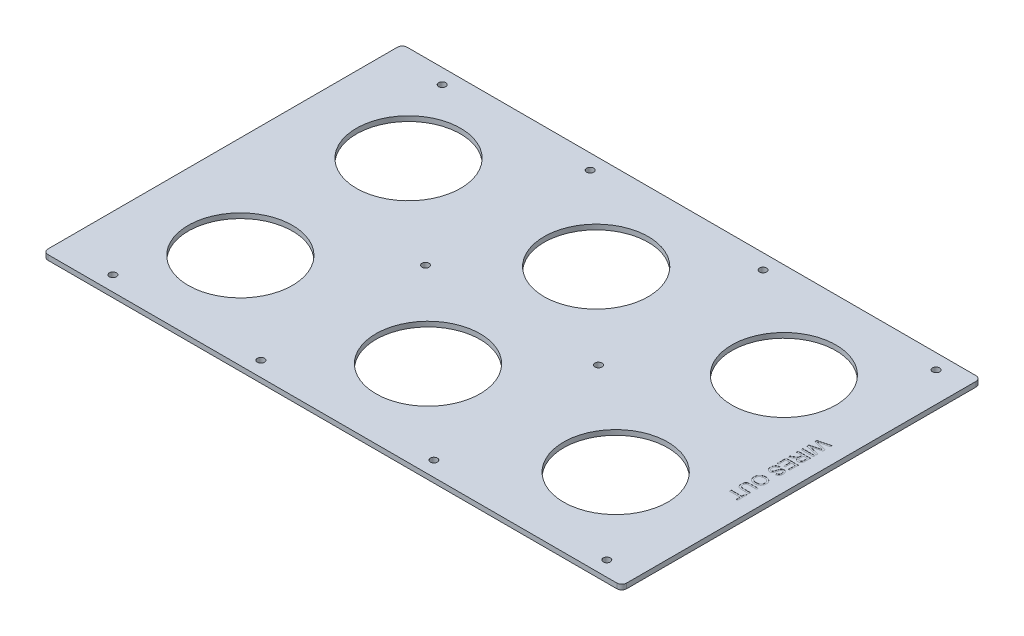
from build123d import *

# Parameters (mm, degrees)
SKETCH1_R           = 33.147
SKETCH1_R_2         = 2.2479
BOSS_EXTRUDE1_DEPTH = 3.175
SKETCH2_W           = 7.704956055
SKETCH2_H           = 1.086596366
CUT_EXTRUDE1_DEPTH  = 0.1


with BuildPart() as part:
    # Sketch1 → Boss-Extrude1 (new body)
    with BuildSketch(Plane(origin=(0, 0, 0), x_dir=(1, 0, 0), z_dir=(0, 1, 0))):
        with BuildLine():
            Line((-180.975, 114.3), (180.975, 114.3))
            ThreePointArc((180.975, 114.3), (183.22006403, 113.37006403), (184.15, 111.125))
            Line((184.15, 111.125), (184.15, -111.125))
            ThreePointArc((184.15, -111.125), (183.22006403, -113.37006403), (180.975, -114.3))
            Line((180.975, -114.3), (-180.975, -114.3))
            ThreePointArc((-180.975, -114.3), (-183.22006403, -113.37006403), (-184.15, -111.125))
            Line((-184.15, -111.125), (-184.15, 111.125))
            ThreePointArc((-184.15, 111.125), (-183.22006403, 113.37006403), (-180.975, 114.3))
        make_face()
        with Locations((119.508581684, -53.5178)):
            Circle(SKETCH1_R, mode=Mode.SUBTRACT)
        with Locations((-55.033333333, 0)):
            Circle(SKETCH1_R_2, mode=Mode.SUBTRACT)
        with Locations((55.033333333, 0)):
            Circle(SKETCH1_R_2, mode=Mode.SUBTRACT)
        with Locations((119.508581684, 53.5178)):
            Circle(SKETCH1_R, mode=Mode.SUBTRACT)
        with Locations((0.064290842, 53.5178)):
            Circle(SKETCH1_R, mode=Mode.SUBTRACT)
        with Locations((0.064290842, -53.5178)):
            Circle(SKETCH1_R, mode=Mode.SUBTRACT)
        with Locations((-119.38, 53.5178)):
            Circle(SKETCH1_R, mode=Mode.SUBTRACT)
        with Locations((-119.38, -53.5178)):
            Circle(SKETCH1_R, mode=Mode.SUBTRACT)
        with Locations((-149.225, -104.775)):
            Circle(SKETCH1_R_2, mode=Mode.SUBTRACT)
        with Locations((-55.033333333, -104.775)):
            Circle(SKETCH1_R_2, mode=Mode.SUBTRACT)
        with Locations((55.033333333, -104.775)):
            Circle(SKETCH1_R_2, mode=Mode.SUBTRACT)
        with Locations((165.1, -104.775)):
            Circle(SKETCH1_R_2, mode=Mode.SUBTRACT)
        with Locations((-149.225, 104.775)):
            Circle(SKETCH1_R_2, mode=Mode.SUBTRACT)
        with Locations((-55.033333333, 104.775)):
            Circle(SKETCH1_R_2, mode=Mode.SUBTRACT)
        with Locations((55.033333333, 104.775)):
            Circle(SKETCH1_R_2, mode=Mode.SUBTRACT)
        with Locations((165.1, 104.775)):
            Circle(SKETCH1_R_2, mode=Mode.SUBTRACT)
    extrude(amount=BOSS_EXTRUDE1_DEPTH)

    # Sketch2 → Cut-Extrude1 (cut)
    # profile 1 of 8: a face of its own
    with BuildSketch(Plane(origin=(0, 3.175, 0), x_dir=(1, 0, 0), z_dir=(0, 1, 0))):
        with BuildLine():
            Line((166.15, 27.961088352), (173.854956055, 29.901218512))
            Line((173.854956055, 29.901218512), (173.854956055, 28.779122548))
            Line((173.854956055, 28.779122548), (168.787774419, 27.635418134))
            add(Edge.make_bspline(
                [(168.787774419, 27.635418134), (168.526439394, 27.576144258), (168.006437361, 27.458201643), (167.486146355, 27.341540415), (167.227335602, 27.283509083)],
                knots=[0, 0, 0, 0, 1.00513078, 2, 2, 2, 2], degree=3))
            add(Edge.make_bspline(
                [(167.227335602, 27.283509083), (167.320397544, 27.256033068), (167.496081531, 27.204163359), (167.745130513, 27.134045564), (167.962493539, 27.070359817), (168.149183924, 27.016102829), (168.305463956, 26.972171156), (168.429413275, 26.934241048), (168.523459211, 26.908388361), (168.575307048, 26.893068011), (168.596385286, 26.886839671)],
                knots=[0, 0, 0, 0, 1.633809233, 3.084334118, 4.356383392, 5.447555203, 6.357852567, 7.089694452, 7.629924063, 8, 8, 8, 8], degree=3))
            Line((168.596385286, 26.886839671), (173.854956055, 25.364987373))
            Line((173.854956055, 25.364987373), (173.854956055, 24.05767612))
            Line((173.854956055, 24.05767612), (169.994760724, 22.957188606))
            add(Edge.make_bspline(
                [(169.994760724, 22.957188606), (169.756292996, 22.89645702), (169.286086246, 22.776707475), (168.585695874, 22.617600876), (167.902297114, 22.470750571), (167.450303241, 22.386162037), (167.227335602, 22.344434689)],
                knots=[0, 0, 0, 0, 1.04154457, 2.053700482, 3.039894486, 4, 4, 4, 4], degree=3))
            add(Edge.make_bspline(
                [(167.227335602, 22.344434689), (167.341544592, 22.318678763), (167.581775196, 22.264502978), (167.961078373, 22.179659286), (168.376649739, 22.085427655), (168.666345356, 22.020262905), (168.817100173, 21.986351796)],
                knots=[0, 0, 0, 0, 0.862132589, 1.813435466, 2.862132822, 4, 4, 4, 4], degree=3))
            Line((168.817100173, 21.986351796), (173.854956055, 20.848821224))
            Line((173.854956055, 20.848821224), (173.854956055, 19.72672526))
            Line((173.854956055, 19.72672526), (166.15, 21.668398882))
            Line((166.15, 21.668398882), (166.15, 22.863037501))
            Line((166.15, 22.863037501), (172.038302754, 24.472867061))
            add(Edge.make_bspline(
                [(172.038302754, 24.472867061), (172.095866386, 24.489032069), (172.205215852, 24.519739564), (172.361261246, 24.559989898), (172.49849675, 24.59990494), (172.618695907, 24.63165342), (172.720647484, 24.659129071), (172.804052983, 24.683459935), (172.870544784, 24.699108893), (172.908336746, 24.710425493), (172.924249224, 24.715190398)],
                knots=[0, 0, 0, 0, 1.562239628, 2.967673567, 4.210417925, 5.296319877, 6.215971374, 6.969386481, 7.566055473, 8, 8, 8, 8], degree=3))
            add(Edge.make_bspline(
                [(172.924249224, 24.715190398), (172.823339965, 24.743760525), (172.632671059, 24.797744024), (172.364249146, 24.877691092), (172.128224928, 24.944775082), (171.982204514, 24.987287741), (171.914825894, 25.00690448)],
                knots=[0, 0, 0, 0, 1.197730334, 2.263121701, 3.198547257, 4, 4, 4, 4], degree=3))
            Line((171.914825894, 25.00690448), (166.15, 26.675385549))
            Line((166.15, 26.675385549), (166.15, 27.961088352))
        make_face()
    # profile 2 of 8: a face of its own
    with BuildSketch(Plane(origin=(0, 3.175, 0), x_dir=(1, 0, 0), z_dir=(0, 1, 0))):
        with Locations((170.002478027, 18.393175174)):
            Rectangle(SKETCH2_W, SKETCH2_H)
    # profile 3 of 8: a face of its own
    with BuildSketch(Plane(origin=(0, 3.175, 0), x_dir=(1, 0, 0), z_dir=(0, 1, 0))):
        with BuildLine():
            Line((166.15, 16.071810209), (173.854956055, 16.071810209))
            Line((173.854956055, 16.071810209), (173.854956055, 12.728674228))
            add(Edge.make_bspline(
                [(173.854956055, 12.728674228), (173.854342169, 12.649953238), (173.853154065, 12.497597974), (173.844664156, 12.276657496), (173.826627338, 12.070918982), (173.80648242, 11.879085777), (173.776738051, 11.701486143), (173.741842552, 11.538035421), (173.700600095, 11.389360543), (173.651849918, 11.254330055), (173.596714064, 11.129041547), (173.528649233, 11.012939725), (173.454187738, 10.901048546), (173.36599881, 10.79779432), (173.271171835, 10.698657305), (173.165018988, 10.607025217), (173.049039409, 10.522450855), (172.88323027, 10.418093644), (172.661277756, 10.308286085), (172.378699292, 10.214565599), (172.082488889, 10.154645397), (171.880129247, 10.148194124), (171.777457888, 10.144920936)],
                knots=[0, 0, 0, 0, 1.242122331, 2.403982386, 3.487329914, 4.500326623, 5.446523787, 6.327028739, 7.136568587, 7.878666205, 8.590811102, 9.292609518, 9.999600102, 10.708452415, 11.431798422, 12.162621657, 12.917616336, 13.694634159, 15.252079616, 16.810286496, 18.381632726, 20, 20, 20, 20], degree=3))
            add(Edge.make_bspline(
                [(171.777457888, 10.144920936), (171.711548467, 10.146428673), (171.581372842, 10.149406557), (171.389979623, 10.172217122), (171.207111885, 10.213491869), (171.031164423, 10.266415741), (170.864643565, 10.338863029), (170.704098084, 10.422752234), (170.554124584, 10.526823622), (170.409729605, 10.643032409), (170.27735816, 10.778133103), (170.155231091, 10.928521812), (170.049716509, 11.097983524), (169.954892757, 11.283399851), (169.87191545, 11.485107238), (169.802148968, 11.704447002), (169.747529022, 11.940642486), (169.720168895, 12.104438229), (169.706133564, 12.188462967)],
                knots=[0, 0, 0, 0, 0.98268397, 1.940868231, 2.867803148, 3.77529712, 4.675825539, 5.571570676, 6.471608834, 7.392971743, 8.331421822, 9.286283743, 10.275919943, 11.301762849, 12.388744527, 13.524158817, 14.729930953, 16, 16, 16, 16], degree=3))
            add(Edge.make_bspline(
                [(169.706133564, 12.188462967), (169.674920512, 12.126355334), (169.615845378, 12.008807813), (169.521004725, 11.846671272), (169.427149071, 11.707441492), (169.358518569, 11.627134073), (169.32644222, 11.589600196)],
                knots=[0, 0, 0, 0, 1.172410807, 2.218954047, 3.167579294, 4, 4, 4, 4], degree=3))
            add(Edge.make_bspline(
                [(169.32644222, 11.589600196), (169.255189411, 11.516690791), (169.109061635, 11.367165608), (168.857854964, 11.163118967), (168.581599523, 10.961217248), (168.380287097, 10.839999673), (168.276888911, 10.777739843)],
                knots=[0, 0, 0, 0, 0.918170575, 1.883016652, 2.912673989, 4, 4, 4, 4], degree=3))
            Line((168.276888911, 10.777739843), (166.15, 9.51364549))
            Line((166.15, 9.51364549), (166.15, 10.759218314))
            Line((166.15, 10.759218314), (167.776807629, 11.719250899))
            add(Edge.make_bspline(
                [(167.776807629, 11.719250899), (167.83388517, 11.753770269), (167.944492072, 11.82066314), (168.106043884, 11.917264227), (168.254720969, 12.012064055), (168.39502939, 12.099702086), (168.523321014, 12.184866155), (168.643423074, 12.262773792), (168.750587872, 12.339419067), (168.879655605, 12.428558525), (169.020135853, 12.53602905), (169.163546222, 12.662288619), (169.280644656, 12.779443783), (169.393767744, 12.926020862), (169.499175465, 13.107903077), (169.548162123, 13.2621855), (169.571852479, 13.336797763)],
                knots=[0, 0, 0, 0, 1.130769053, 2.191244754, 3.190605808, 4.119719489, 4.995392299, 5.800890497, 6.546104885, 7.228445539, 8.4599972, 9.541354885, 10.466489475, 11.262010607, 12.675885558, 14, 14, 14, 14], degree=3))
            add(Edge.make_bspline(
                [(169.571852479, 13.336797763), (169.577500255, 13.368116191), (169.590394299, 13.439617099), (169.59881542, 13.561025464), (169.607753313, 13.708126592), (169.607492893, 13.814733287), (169.607352076, 13.872378643)],
                knots=[0, 0, 0, 0, 0.709978628, 1.620902492, 2.713552433, 4, 4, 4, 4], degree=3))
            Line((169.607352076, 13.872378643), (169.607352076, 14.985213842))
            Line((169.607352076, 14.985213842), (166.15, 14.985213842))
            Line((166.15, 14.985213842), (166.15, 16.071810209))
        make_face()
        with BuildLine():
            Line((170.496385467, 14.985213842), (170.496385467, 12.921606822))
            add(Edge.make_bspline(
                [(170.496385467, 12.921606822), (170.498010953, 12.818131107), (170.501049646, 12.624692964), (170.526814867, 12.354180356), (170.568207731, 12.123224381), (170.627615019, 11.927514221), (170.710466004, 11.763177743), (170.813405324, 11.621997246), (170.938654811, 11.501892323), (171.082675269, 11.403733514), (171.239816603, 11.326421186), (171.406050639, 11.27364311), (171.577781332, 11.236872937), (171.694943274, 11.233318325), (171.754305976, 11.231517303)],
                knots=[0, 0, 0, 0, 1.545806995, 2.889741191, 4.055176196, 5.047087691, 5.934047151, 6.79198357, 7.645535072, 8.5133672, 9.386595861, 10.252007348, 11.114340652, 12, 12, 12, 12], degree=3))
            add(Edge.make_bspline(
                [(171.754305976, 11.231517303), (171.797555017, 11.232951406), (171.882267182, 11.235760394), (172.00660112, 11.250486036), (172.124747101, 11.279116179), (172.237329656, 11.316922214), (172.343524199, 11.367438748), (172.44415362, 11.427450329), (172.538660191, 11.499062672), (172.627331793, 11.58109049), (172.708014285, 11.675273332), (172.777625776, 11.78285228), (172.836780526, 11.902978864), (172.88372969, 12.035792713), (172.921281378, 12.180875438), (172.946263306, 12.339052963), (172.964340145, 12.509601909), (172.965385302, 12.627782438), (172.965922664, 12.688544249)],
                knots=[0, 0, 0, 0, 0.965208469, 1.890559848, 2.786986821, 3.67262109, 4.535197034, 5.405224191, 6.282113641, 7.175449223, 8.095446547, 9.040936516, 10.026471658, 11.075712529, 12.17809725, 13.364958037, 14.645208957, 16, 16, 16, 16], degree=3))
            Line((172.965922664, 12.688544249), (172.965922664, 14.985213842))
            Line((172.965922664, 14.985213842), (170.496385467, 14.985213842))
        make_face(mode=Mode.SUBTRACT)
    # profile 4 of 8: a face of its own
    with BuildSketch(Plane(origin=(0, 3.175, 0), x_dir=(1, 0, 0), z_dir=(0, 1, 0))):
        Polygon((166.15, 8.366854154), (173.854956055, 8.366854154), (173.854956055, 2.933872321), (172.965922664, 2.933872321), (172.965922664, 7.280257787), (170.595166955, 7.280257787), (170.595166955, 3.230216784), (169.706133564, 3.230216784), (169.706133564, 7.280257787), (167.039033391, 7.280257787), (167.039033391, 2.736309345), (166.15, 2.736309345), align=None)
    # profile 5 of 8: a face of its own
    with BuildSketch(Plane(origin=(0, 3.175, 0), x_dir=(1, 0, 0), z_dir=(0, 1, 0))):
        with BuildLine():
            Line((168.817100173, 1.649712978), (168.817100173, 0.563116612))
            add(Edge.make_bspline(
                [(168.817100173, 0.563116612), (168.719529547, 0.55118181), (168.532091121, 0.528254415), (168.266572277, 0.463828653), (168.027103843, 0.381894422), (167.813378129, 0.276322875), (167.622868444, 0.143315233), (167.453133612, -0.02036123), (167.304803803, -0.218512442), (167.174859032, -0.4429847), (167.070412857, -0.691453169), (166.994464873, -0.957129776), (166.949054567, -1.23860425), (166.943227367, -1.431381137), (166.940251903, -1.529816163)],
                knots=[0, 0, 0, 0, 1.125661535, 2.162456423, 3.124646671, 4.021152204, 4.884793578, 5.777140414, 6.711097021, 7.712275503, 8.742730725, 9.791526725, 10.872317486, 12, 12, 12, 12], degree=3))
            add(Edge.make_bspline(
                [(166.940251903, -1.529816163), (166.941819683, -1.616925729), (166.944867379, -1.786262852), (166.983138859, -2.03186214), (167.036140789, -2.263122392), (167.116837446, -2.475819976), (167.216803452, -2.667610301), (167.333562111, -2.836243924), (167.470054812, -2.977492406), (167.621328485, -3.091228496), (167.781808171, -3.179580468), (167.947407209, -3.241156078), (168.114852611, -3.282617797), (168.228290067, -3.287124205), (168.284606215, -3.289361416)],
                knots=[0, 0, 0, 0, 1.267278989, 2.463534024, 3.612003651, 4.716903637, 5.765847919, 6.755281273, 7.693132489, 8.613187884, 9.50174055, 10.350585091, 11.181146174, 12, 12, 12, 12], degree=3))
            add(Edge.make_bspline(
                [(168.284606215, -3.289361416), (168.340361107, -3.286980485), (168.44944591, -3.282322178), (168.607031773, -3.246084289), (168.753131638, -3.18611117), (168.890132122, -3.103620997), (169.016624795, -2.990167719), (169.130896592, -2.845289916), (169.23753008, -2.669664303), (169.294640421, -2.537999343), (169.324898759, -2.468240298)],
                knots=[0, 0, 0, 0, 0.942390321, 1.843792698, 2.718029279, 3.604523015, 4.535311134, 5.574971969, 6.71516581, 8, 8, 8, 8], degree=3))
            add(Edge.make_bspline(
                [(169.324898759, -2.468240298), (169.336038523, -2.441095474), (169.361205274, -2.379770385), (169.394512326, -2.274659324), (169.437633321, -2.149946001), (169.481664466, -2.003028917), (169.529488087, -1.834117372), (169.581413831, -1.643598744), (169.638859547, -1.431720009), (169.698586397, -1.204568749), (169.759741738, -0.974806555), (169.821279669, -0.754883511), (169.882810477, -0.552226285), (169.942950569, -0.365744369), (170.002973634, -0.196521687), (170.061649313, -0.043689521), (170.117725486, 0.092961504), (170.158959254, 0.176422276), (170.178432553, 0.215837943)],
                knots=[0, 0, 0, 0, 0.499203687, 1.127791816, 1.87544445, 2.745218927, 3.737540508, 4.863437871, 6.106074846, 7.473929386, 8.860961239, 10.152791525, 11.360569269, 12.465464948, 13.48744072, 14.416013254, 15.251937243, 16, 16, 16, 16], degree=3))
            add(Edge.make_bspline(
                [(170.178432553, 0.215837943), (170.227453266, 0.306492871), (170.322076001, 0.481480474), (170.490532585, 0.717165955), (170.679258812, 0.914070835), (170.884477608, 1.074916628), (171.105652176, 1.200127373), (171.340782189, 1.287464351), (171.587937475, 1.345042812), (171.75758007, 1.350562364), (171.8438267, 1.353368515)],
                knots=[0, 0, 0, 0, 1.158753891, 2.236696577, 3.247844099, 4.216965963, 5.160353944, 6.094570301, 7.031275781, 8, 8, 8, 8], degree=3))
            add(Edge.make_bspline(
                [(171.8438267, 1.353368515), (171.939353844, 1.349711142), (172.129356641, 1.342436656), (172.408077734, 1.277590875), (172.676902372, 1.174858408), (172.889101036, 1.055430773), (173.050484968, 0.9409555), (173.166533853, 0.846005171), (173.273177181, 0.7394844), (173.374079474, 0.626053123), (173.465299504, 0.500793222), (173.550012637, 0.367603512), (173.62591779, 0.223714846), (173.718462775, 0.020001856), (173.813344915, -0.250954281), (173.895550253, -0.592110615), (173.943672273, -0.951191604), (173.950334996, -1.196284123), (173.953737543, -1.321448962)],
                knots=[0, 0, 0, 0, 1.2001067, 2.387003517, 3.579163215, 4.810460134, 5.437089112, 6.066784591, 6.693680817, 7.331043701, 7.974292474, 8.640345033, 9.314862782, 10.018578828, 11.453312207, 12.917685044, 14.425910937, 16, 16, 16, 16], degree=3))
            add(Edge.make_bspline(
                [(173.953737543, -1.321448962), (173.95064289, -1.458457698), (173.944628528, -1.724729918), (173.893241849, -2.11224948), (173.806583877, -2.473940214), (173.708523054, -2.757920025), (173.609571266, -2.967538932), (173.53234372, -3.116454719), (173.443058966, -3.254678403), (173.346438672, -3.383455396), (173.242524161, -3.503973872), (173.1288586, -3.613166454), (173.009263724, -3.715660518), (172.837994981, -3.836392166), (172.609571361, -3.963703311), (172.316835367, -4.079710236), (172.005116832, -4.153165156), (171.79069382, -4.169895507), (171.681763321, -4.178394807)],
                knots=[0, 0, 0, 0, 1.607767564, 3.124646298, 4.577694013, 5.968230118, 6.64098443, 7.297468537, 7.935727887, 8.569831019, 9.186231226, 9.801209789, 10.418260488, 11.033239051, 12.257996117, 13.47812891, 14.718847046, 16, 16, 16, 16], degree=3))
            Line((171.681763321, -4.178394807), (171.681763321, -3.09179844))
            add(Edge.make_bspline(
                [(171.681763321, -3.09179844), (171.736991235, -3.085121667), (171.845167038, -3.072043764), (172.000627725, -3.035343897), (172.146673573, -2.991484403), (172.281547317, -2.935573378), (172.406478451, -2.869526654), (172.519006724, -2.789517406), (172.623476803, -2.701824511), (172.7170098, -2.602061317), (172.79917029, -2.490043204), (172.870345488, -2.365689122), (172.93051157, -2.22903876), (172.979778568, -2.080142075), (173.017981321, -1.918989761), (173.04608314, -1.745209435), (173.060475535, -1.558869965), (173.063269785, -1.430540804), (173.064704152, -1.364665863)],
                knots=[0, 0, 0, 0, 1.074597235, 2.104830896, 3.08320792, 4.01963776, 4.922947153, 5.808618242, 6.683501764, 7.556007728, 8.44518997, 9.363001905, 10.32032511, 11.326760392, 12.390579697, 13.518793479, 14.726327422, 16, 16, 16, 16], degree=3))
            add(Edge.make_bspline(
                [(173.064704152, -1.364665863), (173.064188603, -1.296191701), (173.063190627, -1.163642565), (173.04497071, -0.972031657), (173.020009591, -0.794419061), (172.983061434, -0.631172241), (172.935259434, -0.48306628), (172.878759403, -0.348127523), (172.808568824, -0.229165201), (172.730017114, -0.123337493), (172.6422554, -0.032590228), (172.552332374, 0.04825144), (172.456418072, 0.114942834), (172.357692752, 0.172218581), (172.251920942, 0.212597101), (172.143699666, 0.244199872), (172.030749928, 0.26343676), (171.954001215, 0.265644988), (171.914825894, 0.266772148)],
                knots=[0, 0, 0, 0, 1.464643987, 2.835190547, 4.115048982, 5.300866033, 6.411522794, 7.442255218, 8.424145068, 9.359957701, 10.255529779, 11.121374133, 11.943044406, 12.751479056, 13.556984722, 14.358492815, 15.162115312, 16, 16, 16, 16], degree=3))
            add(Edge.make_bspline(
                [(171.914825894, 0.266772148), (171.848535839, 0.263964127), (171.719872954, 0.258514018), (171.537081779, 0.202860432), (171.370455779, 0.117264828), (171.279795424, 0.032939519), (171.234159704, -0.009507326)],
                knots=[0, 0, 0, 0, 1.050964922, 2.039826012, 3.013306874, 4, 4, 4, 4], degree=3))
            add(Edge.make_bspline(
                [(171.234159704, -0.009507326), (171.211353151, -0.036265364), (171.160917867, -0.095439112), (171.094172776, -0.205541019), (171.026734837, -0.342050915), (170.95969881, -0.50588171), (170.892236885, -0.696747973), (170.822828427, -0.914357869), (170.75352998, -1.159949087), (170.68786178, -1.425399641), (170.620323302, -1.693158031), (170.554159897, -1.94737748), (170.491105264, -2.181180377), (170.429661483, -2.39378823), (170.3699322, -2.585403373), (170.310682432, -2.755364006), (170.256187029, -2.905044225), (170.217845165, -2.996741066), (170.200041003, -3.039320775)],
                knots=[0, 0, 0, 0, 0.523891657, 1.158554055, 1.913784378, 2.794767528, 3.797522645, 4.933640231, 6.202082727, 7.603978424, 9.013314845, 10.322177672, 11.523239011, 12.626145434, 13.623952425, 14.517289202, 15.3114987, 16, 16, 16, 16], degree=3))
            add(Edge.make_bspline(
                [(170.200041003, -3.039320775), (170.174500713, -3.094720645), (170.124369403, -3.203461308), (170.03874435, -3.35748149), (169.949951708, -3.501295096), (169.854808999, -3.633621889), (169.755274208, -3.755235267), (169.650208558, -3.865395), (169.539279991, -3.963419415), (169.387095799, -4.079694724), (169.18160789, -4.198915332), (168.916061967, -4.301366499), (168.632339623, -4.365447691), (168.436720388, -4.372411065), (168.33708388, -4.375957782)],
                knots=[0, 0, 0, 0, 0.899337291, 1.765248388, 2.59684015, 3.3906421, 4.166844185, 4.912752363, 5.632941945, 6.347675468, 7.734877245, 9.118505574, 10.532342477, 12, 12, 12, 12], degree=3))
            add(Edge.make_bspline(
                [(168.33708388, -4.375957782), (168.236386957, -4.371936712), (168.036470096, -4.36395355), (167.741783397, -4.295215649), (167.456233631, -4.187232042), (167.229634162, -4.060594514), (167.056545098, -3.940883774), (166.93213659, -3.840321106), (166.817101966, -3.728802888), (166.70783741, -3.609074587), (166.606572276, -3.480206624), (166.513272081, -3.341112563), (166.426965579, -3.193260476), (166.321796053, -2.982131414), (166.211778741, -2.701716945), (166.12016005, -2.344525205), (166.060724739, -1.968088374), (166.054431046, -1.70960361), (166.051218512, -1.577663446)],
                knots=[0, 0, 0, 0, 1.197055466, 2.376552968, 3.581957237, 4.820753935, 5.454298064, 6.085440993, 6.72202542, 7.359198513, 8.013298489, 8.67051481, 9.351020706, 10.049282741, 11.476266879, 12.925760103, 14.430794493, 16, 16, 16, 16], degree=3))
            add(Edge.make_bspline(
                [(166.051218512, -1.577663446), (166.051932124, -1.493774815), (166.053334356, -1.328935451), (166.069501726, -1.087448361), (166.093600447, -0.856087262), (166.128757691, -0.635455897), (166.175582001, -0.424932359), (166.230391417, -0.224755681), (166.295589613, -0.034943867), (166.370653227, 0.144407329), (166.45847565, 0.31317942), (166.552967218, 0.474260222), (166.660935572, 0.624666673), (166.777495386, 0.766440108), (166.90495526, 0.898586507), (167.042667389, 1.020296391), (167.189846784, 1.133703907), (167.346843703, 1.236636861), (167.51179862, 1.328556123), (167.681888346, 1.411227403), (167.858361077, 1.480876648), (168.04032109, 1.537007954), (168.226551739, 1.584553832), (168.418606514, 1.617525841), (168.61588251, 1.641767961), (168.749631443, 1.647048996), (168.817100173, 1.649712978)],
                knots=[0, 0, 0, 0, 1.259794174, 2.475468585, 3.633483936, 4.752716887, 5.828920721, 6.87130154, 7.868357378, 8.841438305, 9.788394823, 10.72402761, 11.64389108, 12.56602382, 13.478685853, 14.398289622, 15.324106125, 16.267144882, 17.215109807, 18.158654996, 19.105737623, 20.061356657, 21.017194371, 21.990367343, 22.986254633, 24, 24, 24, 24], degree=3))
        make_face()
    # profile 6 of 8: a face of its own
    with BuildSketch(Plane(origin=(0, 3.175, 0), x_dir=(1, 0, 0), z_dir=(0, 1, 0))):
        with BuildLine():
            add(Edge.make_bspline(
                [(169.900609618, -8.425998786), (170.055081669, -8.428694796), (170.356062626, -8.433947835), (170.794424224, -8.482451377), (171.206372887, -8.562468316), (171.593814211, -8.672539898), (171.953826157, -8.818938733), (172.290835694, -8.992648386), (172.598977129, -9.203414764), (172.881813297, -9.44156709), (173.13183827, -9.707645267), (173.353902315, -9.990924446), (173.539128475, -10.294964077), (173.692064615, -10.61694928), (173.809484454, -10.958249569), (173.891689051, -11.317906262), (173.944718998, -11.695534823), (173.950687696, -11.953652778), (173.953737543, -12.085544219)],
                knots=[0, 0, 0, 0, 1.203593535, 2.345140965, 3.431924157, 4.471254512, 5.478692091, 6.45615896, 7.42038538, 8.382007041, 9.33218277, 10.260966195, 11.182476517, 12.100814648, 13.034113903, 13.98924309, 14.972556454, 16, 16, 16, 16], degree=3))
            add(Edge.make_bspline(
                [(173.953737543, -12.085544219), (173.95223205, -12.172538328), (173.949242413, -12.345292894), (173.92604708, -12.601155131), (173.88575633, -12.850128244), (173.82976435, -13.09239012), (173.759109178, -13.328180354), (173.672548098, -13.557980453), (173.568394749, -13.780318023), (173.450509038, -13.995778855), (173.317137252, -14.201003465), (173.172838256, -14.395800246), (173.014428229, -14.576977984), (172.844200606, -14.745618019), (172.662077441, -14.902086759), (172.465794782, -15.044435187), (172.258348333, -15.175541601), (172.038126778, -15.292583269), (171.80954347, -15.397424581), (171.571444416, -15.486980624), (171.326741852, -15.563894658), (171.07397214, -15.628274471), (170.81322586, -15.674469633), (170.5456254, -15.71125507), (170.270296467, -15.730616317), (170.084306855, -15.734076707), (169.990130341, -15.735828889)],
                knots=[0, 0, 0, 0, 1.034309052, 2.053950705, 3.051627699, 4.031038476, 5.008402854, 5.97643726, 6.948041091, 7.925482047, 8.894385902, 9.856059247, 10.805611944, 11.752954998, 12.703138077, 13.657545741, 14.63347317, 15.618750787, 16.620694897, 17.621667406, 18.641309059, 19.669521506, 20.720627516, 21.788266251, 22.880080611, 24, 24, 24, 24], degree=3))
            add(Edge.make_bspline(
                [(169.990130341, -15.735828889), (169.894400856, -15.734223508), (169.705270752, -15.731051801), (169.425867721, -15.709590737), (169.154485773, -15.671854724), (168.89031569, -15.621804333), (168.633907442, -15.554738322), (168.384525807, -15.475040727), (168.143656456, -15.378641786), (167.910717724, -15.269770601), (167.688917422, -15.146580274), (167.479791576, -15.010702469), (167.285350504, -14.861997946), (167.103010706, -14.702881937), (166.937034874, -14.529344076), (166.782553665, -14.345109437), (166.644492727, -14.147092662), (166.518944798, -13.93910018), (166.411027958, -13.721828008), (166.314145289, -13.50016061), (166.232639446, -13.273833225), (166.165956648, -13.043411329), (166.115039301, -12.808700966), (166.077899318, -12.570128905), (166.055994419, -12.326734054), (166.052818662, -12.163274971), (166.051218512, -12.080913837)],
                knots=[0, 0, 0, 0, 1.141388526, 2.255009839, 3.338557341, 4.406873761, 5.458773361, 6.496627797, 7.526383469, 8.5499449, 9.560445588, 10.548978906, 11.520676971, 12.476877461, 13.431305422, 14.380871584, 15.340724931, 16.306479833, 17.274880643, 18.230982746, 19.189541512, 20.140849708, 21.088988189, 22.051132196, 23.018035844, 24, 24, 24, 24], degree=3))
            add(Edge.make_bspline(
                [(166.051218512, -12.080913837), (166.052528787, -11.99235929), (166.055124115, -11.816954908), (166.081026503, -11.557701725), (166.120549018, -11.304901397), (166.177580407, -11.059274573), (166.252078913, -10.821209344), (166.341729647, -10.590664853), (166.447011444, -10.367082235), (166.569050918, -10.151990124), (166.703771887, -9.945588467), (166.852902666, -9.752061504), (167.013159083, -9.570855645), (167.186954622, -9.404194744), (167.370984715, -9.249456036), (167.566441848, -9.106345782), (167.774479892, -8.977040926), (167.993938674, -8.862215955), (168.219261686, -8.75867657), (168.450327829, -8.671394586), (168.683783429, -8.59470373), (168.921053663, -8.533623993), (169.16159486, -8.48495174), (169.40500579, -8.452222973), (169.651649233, -8.428586066), (169.817205205, -8.426865552), (169.900609618, -8.425998786)],
                knots=[0, 0, 0, 0, 1.072763531, 2.124875893, 3.153923666, 4.171672792, 5.177320289, 6.174136357, 7.166947757, 8.169130198, 9.168574722, 10.151174515, 11.127106349, 12.097106019, 13.066163601, 14.038804255, 15.030068075, 16.031241659, 17.038395341, 18.032966873, 19.022680693, 20.014630449, 21.000093848, 21.9946263, 22.989725266, 24, 24, 24, 24], degree=3))
        make_face()
        with BuildLine():
            add(Edge.make_bspline(
                [(169.888261932, -9.512595152), (169.77702354, -9.514259367), (169.560116526, -9.517504467), (169.243885821, -9.554664291), (168.945475501, -9.610982081), (168.664187725, -9.688837377), (168.402090309, -9.792783692), (168.158679948, -9.919870313), (167.932806148, -10.068946061), (167.727028661, -10.239932497), (167.542110003, -10.427808901), (167.380522743, -10.6285772), (167.245780728, -10.842050877), (167.133236179, -11.06540357), (167.046521017, -11.301596651), (166.985221165, -11.549498526), (166.946958365, -11.809104334), (166.942515242, -11.986114189), (166.940251903, -12.076283455)],
                knots=[0, 0, 0, 0, 1.215616022, 2.370365452, 3.475740397, 4.533490648, 5.5560781, 6.552384115, 7.530550651, 8.509299237, 9.471863928, 10.40830403, 11.321168121, 12.226759389, 13.137923578, 14.065605683, 15.014614662, 16, 16, 16, 16], degree=3))
            add(Edge.make_bspline(
                [(166.940251903, -12.076283455), (166.942547084, -12.167981906), (166.947041042, -12.347527214), (166.984658358, -12.611035426), (167.048700226, -12.861397749), (167.133954491, -13.101095614), (167.249203608, -13.325795898), (167.38416011, -13.540752261), (167.54907148, -13.740110402), (167.734322624, -13.928742793), (167.94487094, -14.097996592), (168.175640444, -14.247932155), (168.429498885, -14.370569547), (168.702795399, -14.472871113), (168.997245083, -14.553118235), (169.312845349, -14.609218486), (169.648764275, -14.643815053), (169.879429026, -14.647394768), (169.997847645, -14.649232522)],
                knots=[0, 0, 0, 0, 0.976909331, 1.912785716, 2.828990727, 3.727421029, 4.617481149, 5.514840137, 6.426786422, 7.368873452, 8.327895072, 9.299698503, 10.295216142, 11.325792517, 12.405818789, 13.542541501, 14.738390493, 16, 16, 16, 16], degree=3))
            add(Edge.make_bspline(
                [(169.997847645, -14.649232522), (170.074026949, -14.648576465), (170.223463174, -14.647289517), (170.443733875, -14.630246006), (170.657152916, -14.60826209), (170.863444819, -14.574791138), (171.061755607, -14.528664261), (171.25359385, -14.477562353), (171.437310628, -14.413665527), (171.613611038, -14.341150391), (171.781645562, -14.260062351), (171.939797177, -14.168406551), (172.08844042, -14.067965498), (172.227160837, -13.958538977), (172.356248251, -13.840512018), (172.475392601, -13.713550008), (172.585291485, -13.577342457), (172.684993755, -13.432678235), (172.774801118, -13.281839518), (172.85157848, -13.125047311), (172.919495675, -12.964474231), (172.970301799, -12.797906792), (173.012868442, -12.628041867), (173.044233091, -12.453881376), (173.06071217, -12.274169217), (173.063363936, -12.152971849), (173.064704152, -12.091718062)],
                knots=[0, 0, 0, 0, 1.220471707, 2.394123819, 3.538599016, 4.658184489, 5.740257119, 6.800339203, 7.838063059, 8.854709651, 9.853990799, 10.825506309, 11.781362566, 12.726491381, 13.654344845, 14.581758638, 15.513997413, 16.45624495, 17.395131889, 18.32430312, 19.252156584, 20.185670527, 21.111507116, 22.057642305, 23.018322208, 24, 24, 24, 24], degree=3))
            add(Edge.make_bspline(
                [(173.064704152, -12.091718062), (173.062940709, -12.005153248), (173.059450855, -11.833841485), (173.022280059, -11.58227072), (172.965226381, -11.339996794), (172.886881467, -11.106580908), (172.781927429, -10.883305753), (172.655519592, -10.668690572), (172.505870504, -10.463724928), (172.334786896, -10.268536293), (172.137326902, -10.086645702), (171.904702471, -9.932781615), (171.642270604, -9.803127369), (171.350752665, -9.694860824), (171.027874716, -9.612312878), (170.67503106, -9.555261338), (170.291848458, -9.519240323), (170.026230008, -9.514866837), (169.888261932, -9.512595152)],
                knots=[0, 0, 0, 0, 0.895069985, 1.771343461, 2.624796936, 3.468163849, 4.31361133, 5.172690577, 6.041527277, 6.935393444, 7.854933085, 8.810158187, 9.810009302, 10.877887247, 12.021813459, 13.252239476, 14.572752642, 16, 16, 16, 16], degree=3))
        make_face(mode=Mode.SUBTRACT)
    # profile 7 of 8: a face of its own
    with BuildSketch(Plane(origin=(0, 3.175, 0), x_dir=(1, 0, 0), z_dir=(0, 1, 0))):
        with BuildLine():
            Line((173.854956055, -21.959062625), (173.854956055, -23.045658992))
            Line((173.854956055, -23.045658992), (169.422136786, -23.045658992))
            add(Edge.make_bspline(
                [(169.422136786, -23.045658992), (169.327978025, -23.044530037), (169.144744923, -23.04233309), (168.87751552, -23.032256431), (168.625152076, -23.012526979), (168.387984581, -22.98263983), (168.165358078, -22.947868846), (167.95747002, -22.905126483), (167.76487779, -22.852521728), (167.585292653, -22.792891256), (167.417944256, -22.72031767), (167.258473681, -22.637942355), (167.108464103, -22.539540722), (166.965998728, -22.429681499), (166.830860433, -22.307236666), (166.704516797, -22.170910437), (166.585596562, -22.022206858), (166.473731591, -21.86168919), (166.373517385, -21.687440869), (166.286556153, -21.499507166), (166.214593946, -21.297743823), (166.154185521, -21.083313868), (166.108679796, -20.855622672), (166.074457981, -20.615568659), (166.054276394, -20.362444742), (166.052252901, -20.18926407), (166.051218512, -20.100735884)],
                knots=[0, 0, 0, 0, 1.311228972, 2.551653728, 3.723130164, 4.834785825, 5.879510353, 6.860250358, 7.788314549, 8.658288427, 9.492697459, 10.325875345, 11.154513055, 11.987074685, 12.828985206, 13.690719442, 14.572384718, 15.478595216, 16.41253076, 17.367739602, 18.35808817, 19.392369757, 20.467218117, 21.588802345, 22.767420464, 24, 24, 24, 24], degree=3))
            add(Edge.make_bspline(
                [(166.051218512, -20.100735884), (166.052490787, -20.01427752), (166.054969714, -19.845820141), (166.071742685, -19.598962732), (166.101437547, -19.364139321), (166.140500218, -19.140676798), (166.19299588, -18.929675729), (166.258309816, -18.731388235), (166.333642949, -18.544522173), (166.419653938, -18.3688505), (166.519724411, -18.206995458), (166.626597632, -18.054786855), (166.747028022, -17.916727312), (166.876478573, -17.790158702), (167.016013245, -17.674891964), (167.166962781, -17.573185792), (167.327162206, -17.481098069), (167.500752098, -17.404668778), (167.686027254, -17.335656808), (167.886890931, -17.277853527), (168.103807622, -17.228240495), (168.33641729, -17.189491727), (168.58486153, -17.155679983), (168.849788182, -17.136023373), (169.130766664, -17.121064253), (169.323332391, -17.119547802), (169.422136786, -17.118769719)],
                knots=[0, 0, 0, 0, 1.193081066, 2.324625372, 3.412172001, 4.45804146, 5.453311625, 6.409738988, 7.336564304, 8.231938232, 9.104965612, 9.959995908, 10.795526766, 11.6289435, 12.456168255, 13.289131264, 14.138038169, 15.002361749, 15.903123796, 16.86470204, 17.884288495, 18.972113175, 20.117801365, 21.342981521, 22.636698715, 24, 24, 24, 24], degree=3))
            Line((169.422136786, -17.118769719), (173.854956055, -17.118769719))
            Line((173.854956055, -17.118769719), (173.854956055, -18.205366086))
            Line((173.854956055, -18.205366086), (169.473070991, -18.205366086))
            add(Edge.make_bspline(
                [(169.473070991, -18.205366086), (169.39332164, -18.206076084), (169.239444092, -18.207446037), (169.016535136, -18.214593494), (168.809677124, -18.228887412), (168.618553588, -18.246557744), (168.443856941, -18.27085368), (168.28583575, -18.301959253), (168.143975526, -18.336874351), (167.978002618, -18.389053433), (167.793455941, -18.47620245), (167.595481423, -18.610760483), (167.426591401, -18.779480668), (167.285005806, -18.977727043), (167.173640734, -19.202906266), (167.095570728, -19.453429361), (167.046645574, -19.726855205), (167.041627536, -19.917360943), (167.039033391, -20.015845543)],
                knots=[0, 0, 0, 0, 1.09016621, 2.103491781, 3.048002782, 3.92413717, 4.726764113, 5.45776374, 6.124688997, 6.722968542, 7.833563451, 8.900618832, 9.979749949, 11.078524919, 12.217069639, 13.398089285, 14.65490594, 16, 16, 16, 16], degree=3))
            add(Edge.make_bspline(
                [(167.039033391, -20.015845543), (167.040468925, -20.100266075), (167.043240797, -20.263273579), (167.06564222, -20.498316998), (167.106366495, -20.713826909), (167.159315803, -20.911914567), (167.230118179, -21.091158161), (167.316370904, -21.251970548), (167.420011725, -21.392506358), (167.538807414, -21.518084151), (167.683187687, -21.625266473), (167.85567465, -21.713387136), (168.054662189, -21.790732774), (168.282705055, -21.853511759), (168.54014894, -21.899480612), (168.825495002, -21.935352521), (169.139948227, -21.954176827), (169.358833523, -21.957387143), (169.473070991, -21.959062625)],
                knots=[0, 0, 0, 0, 1.111455303, 2.146107705, 3.104026802, 3.996399357, 4.841714416, 5.635894114, 6.391918333, 7.134500369, 7.904030117, 8.746408724, 9.677288091, 10.711075296, 11.855002337, 13.117843725, 14.495786417, 16, 16, 16, 16], degree=3))
            Line((169.473070991, -21.959062625), (173.854956055, -21.959062625))
        make_face()
    # profile 8 of 8: a face of its own
    with BuildSketch(Plane(origin=(0, 3.175, 0), x_dir=(1, 0, 0), z_dir=(0, 1, 0))):
        Polygon((166.15, -26.700574043), (172.965922664, -26.700574043), (172.965922664, -24.231036846), (173.854956055, -24.231036846), (173.854956055, -30.256707607), (172.965922664, -30.256707607), (172.965922664, -27.78717041), (166.15, -27.78717041), align=None)
    extrude(amount=-CUT_EXTRUDE1_DEPTH, mode=Mode.SUBTRACT)


solid = part.part
